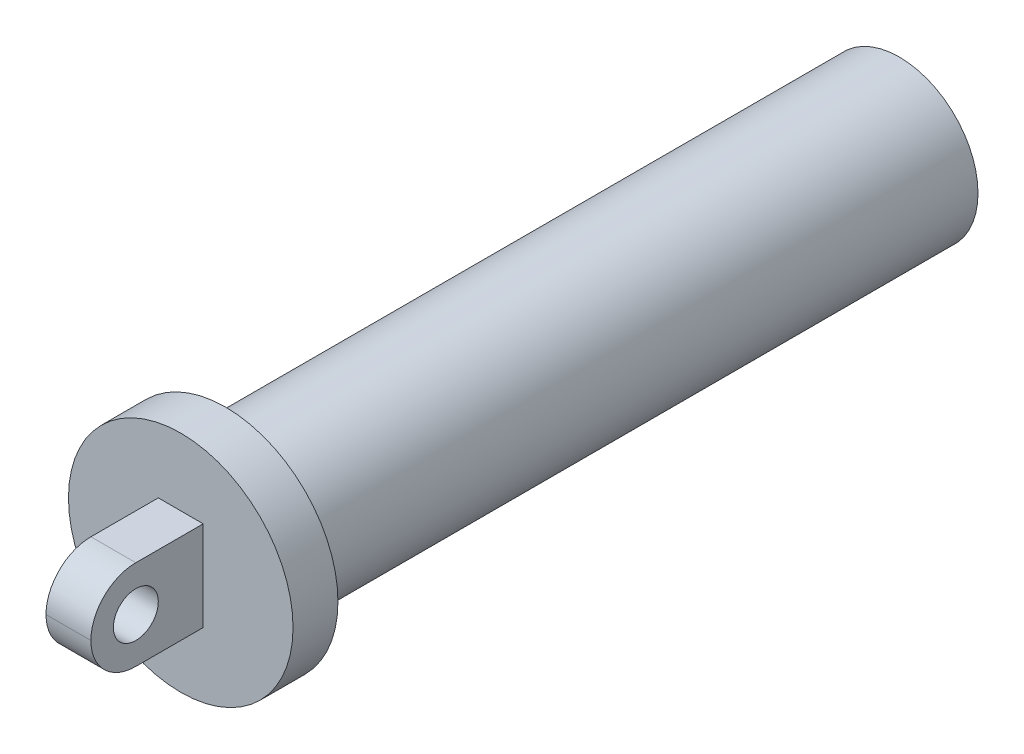
from build123d import *

# Parameters (mm, degrees)
SKETCH2_R           = 25
BOSS_EXTRUDE2_DEPTH = 10
SKETCH3_W           = 10
SKETCH3_H           = 20
BOSS_EXTRUDE3_DEPTH = 25
SKETCH4_R           = 5
CUT_EXTRUDE1_DEPTH  = 20
FILLET1_R           = 10
SKETCH5_R           = 17.5
SKETCH5_R_2         = 12.5
BOSS_EXTRUDE4_DEPTH = 150


with BuildPart() as part:
    # Sketch2 → Boss-Extrude2 (new body)
    with BuildSketch(Plane.XY):
        Circle(SKETCH2_R)
    extrude(amount=BOSS_EXTRUDE2_DEPTH)

    # Sketch3 → Boss-Extrude3 (add)
    with BuildSketch(Plane.XY.offset(10)):
        Rectangle(SKETCH3_W, SKETCH3_H)
    extrude(amount=BOSS_EXTRUDE3_DEPTH)

    # Sketch4 → Cut-Extrude1 (cut)
    with BuildSketch(Plane.ZY.offset(5)):
        with Locations(Location((25, 0, 0), (0, 0, 270))):
            Circle(SKETCH4_R)
    extrude(amount=-CUT_EXTRUDE1_DEPTH, mode=Mode.SUBTRACT)

    # Fillet1
    fillet1_edges = [part.edges().sort_by_distance(p)[0] for p in [
        (0, -10, 35),
        (0, 10, 35),
    ]]
    fillet(fillet1_edges, radius=FILLET1_R - 0.0001)  # a hair under: the kernel refuses the full size

    # Sketch5 → Boss-Extrude4 (add)
    with BuildSketch(Plane(origin=(0, 0, 0), x_dir=(-1, 0, 0), z_dir=(0, 0, -1))):
        with Locations(Location((0, 0, 0), (0, 0, 180))):
            Circle(SKETCH5_R)
        Circle(SKETCH5_R_2, mode=Mode.SUBTRACT)
    extrude(amount=BOSS_EXTRUDE4_DEPTH)


solid = part.part
